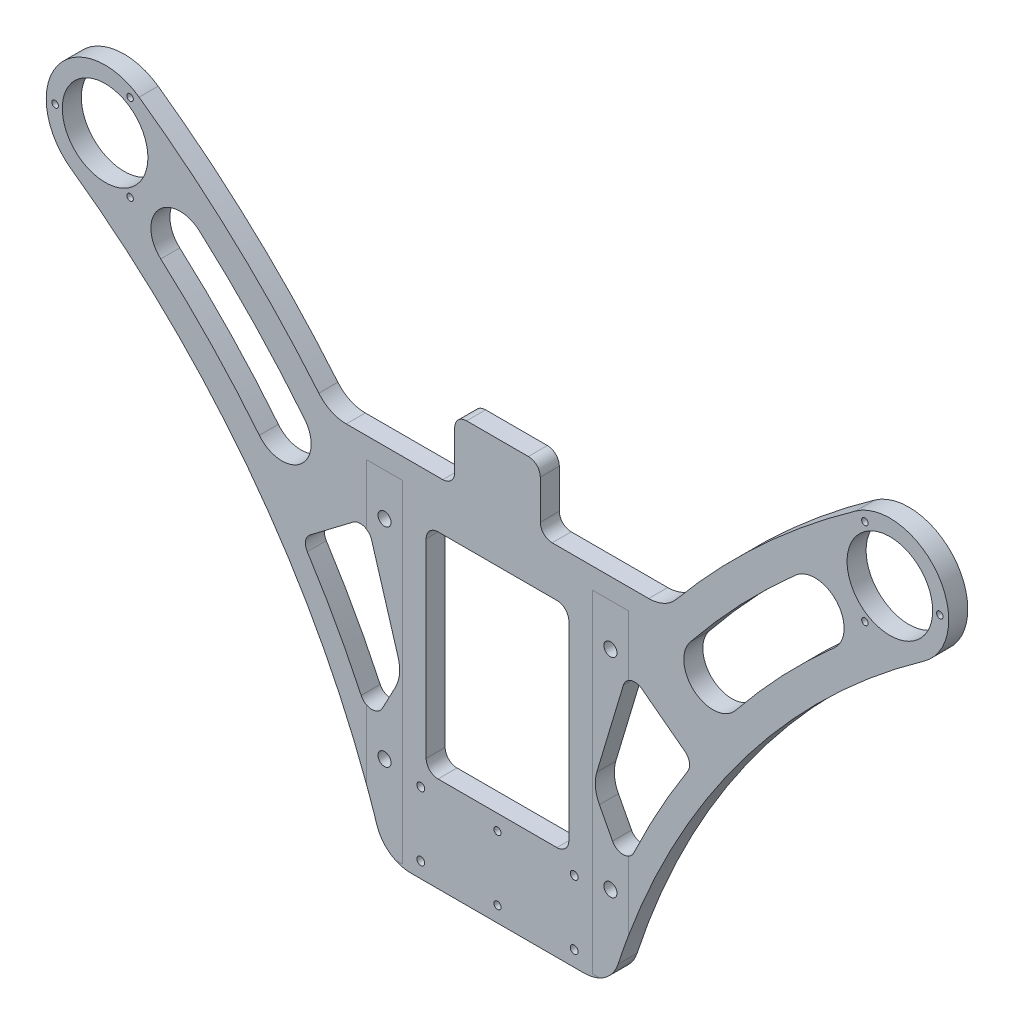
from build123d import *

# Parameters (mm, degrees)
ESTRUSIONE_ESTRUSIONE1_DEPTH  = 16
SCHIZZO3_R                    = 36
TAGLIO_ESTRUSIONE1_DEPTH      = 597.553643858
TAGLIO_ESTRUSIONE4_DEPTH      = 597.553643858
TAGLIO_ESTRUSIONE4_DEPTH_BACK = 597.553643858
RACCORDO2_R                   = 10
TAGLIO_ESTRUSIONE16_DEPTH     = 597.553643858
RACCORDO3_R                   = 30
SCHIZZO39_W                   = 120
SCHIZZO39_H                   = 180
TAGLIO_ESTRUSIONE25_DEPTH     = 597.553643858
RACCORDO5_R                   = 10
TAGLIO_ESTRUSIONE26_DEPTH     = 597.553643858
RACCORDO6_R                   = 10
RACCORDO7_R                   = 30
M6_CLEARANCE_HOLE1_D          = 6.6
RIPETIZIONE_A_L3_COUNT        = 2
RIPETIZIONE_A_L3_PITCH        = 54
RIPETIZIONE_A_L3_COUNT_DIR2   = 2
RIPETIZIONE_A_L3_PITCH_DIR2   = 129
F_6_0_6_DIAMETER_HOLE2_D      = 6
RIPETIZIONE_A_L4_COUNT        = 2
RIPETIZIONE_A_L4_PITCH        = 54
F_11_0_11_DIAMETER_HOLE1_D    = 11
RIPETIZIONE_A_L5_COUNT        = 2
RIPETIZIONE_A_L5_PITCH        = 190
RIPETIZIONE_A_L5_COUNT_DIR2   = 2
RIPETIZIONE_A_L5_PITCH_DIR2   = 175
M5_CLEARANCE_HOLE1_D          = 5.5
RIPETIZIONECIRCOLARE1_COUNT   = 3
SPECCHIA7_COPY_1_D            = 5.5
SPECCHIA7_COPY_2_D            = 5.5


# Read off the part's stored shape, not the designer's step: Specchia8
with BuildPart() as part:
    # Schizzo2 → Estrusione-Estrusione1 (new body)
    with BuildSketch(Plane.XY):
        with BuildLine():
            Line((-330, 0), (330, 0))
            ThreePointArc((330, 0), (377.167935033, -34.485476873), (358.614305107, -89.891478597))
            ThreePointArc((358.614305107, -89.891478597), (195.466897987, -252.623261021), (95, -460))
            Line((95, -460), (-95, -460))
            ThreePointArc((-95, -460), (-195.466897987, -252.623261021), (-358.614305107, -89.891478597))
            ThreePointArc((-358.614305107, -89.891478597), (-377.167935033, -34.485476873), (-330, 0))
        make_face()
    extrude(amount=-ESTRUSIONE_ESTRUSIONE1_DEPTH)

    # Schizzo3 → Taglio-Estrusione1 (cut, symmetric)
    with BuildSketch(Plane.XY):
        with Locations((-330, -49.5)):
            Circle(SCHIZZO3_R)
    taglio_estrusione1 = extrude(amount=TAGLIO_ESTRUSIONE1_DEPTH, both=True, mode=Mode.SUBTRACT)

    # Specchia1: Taglio-Estrusione1 across plane
    add(taglio_estrusione1.mirror(Plane(origin=(0, 0, 0), x_dir=(0, 0, 1), z_dir=(1, 0, 0))), mode=Mode.SUBTRACT)

    # Schizzo12 → Taglio-Estrusione4 (cut, two sides: drawn at the far end of the back side and taken through both)
    with BuildSketch(Plane(origin=(0, 0, -16), x_dir=(-1, 0, 0), z_dir=(0, 0, -1)).offset(-TAGLIO_ESTRUSIONE4_DEPTH_BACK)):
        with BuildLine():
            Line((-330, 0), (330, 0))
            ThreePointArc((330, 0), (314.985476873, -2.332064967), (301.385694893, -9.108521403))
            ThreePointArc((301.385694893, -9.108521403), (216.113325417, -78.953204124), (141.406742184, -160))
            Line((141.406742184, -160), (36, -160))
            Line((36, -160), (36, -107.15))
            Line((36, -107.15), (-36, -107.15))
            Line((-36, -107.15), (-36, -160))
            Line((-36, -160), (-141.406742184, -160))
            ThreePointArc((-141.406742184, -160), (-216.113325417, -78.953204124), (-301.385694893, -9.108521403))
            ThreePointArc((-301.385694893, -9.108521403), (-314.985476873, -2.332064967), (-330, 0))
        make_face()
    extrude(amount=TAGLIO_ESTRUSIONE4_DEPTH + TAGLIO_ESTRUSIONE4_DEPTH_BACK, mode=Mode.SUBTRACT)

    # Raccordo2
    raccordo2_edges = [part.edges().sort_by_distance(p)[0] for p in [
        (36, -160, -8),
        (36, -107.15, -8),
        (-36, -160, -8),
        (-36, -107.15, -8),
    ]]
    fillet(raccordo2_edges, radius=RACCORDO2_R)

    # Schizzo24 → Taglio-Estrusione16 (cut, through all)
    with BuildSketch(Plane(origin=(0, 0, -16), x_dir=(-1, 0, 0), z_dir=(0, 0, -1))):
        with BuildLine():
            ThreePointArc((200.293142061, -204.853472831), (239.934023772, -159.597976721), (283.239119921, -117.835217253))
            ThreePointArc((283.239119921, -117.835217253), (285.324112305, -83.249775131), (250.738670183, -81.164782747))
            ThreePointArc((250.738670183, -81.164782747), (204.4658122, -125.789605452), (162.108282651, -174.146527169))
            ThreePointArc((162.108282651, -174.146527169), (165.847239525, -208.592429705), (200.293142061, -204.853472831))
        make_face()
    taglio_estrusione16 = extrude(amount=-TAGLIO_ESTRUSIONE16_DEPTH, mode=Mode.SUBTRACT)

    # Specchia3: Taglio-Estrusione16 across plane
    add(taglio_estrusione16.mirror(Plane(origin=(0, 0, 0), x_dir=(0, 0, 1), z_dir=(1, 0, 0))), mode=Mode.SUBTRACT)

    # Raccordo3
    raccordo3_edges = [part.edges().sort_by_distance(p)[0] for p in [
        (-141.406742184, -160, -8),
        (141.406742184, -160, -8),
        (-95, -460, -8),
        (95, -460, -8),
    ]]
    fillet(raccordo3_edges, radius=RACCORDO3_R)

    # Schizzo39 → Taglio-Estrusione25 (cut, through all)
    with BuildSketch(Plane(origin=(0, 0, -16), x_dir=(-1, 0, 0), z_dir=(0, 0, -1))):
        with Locations((0, -290)):
            Rectangle(SCHIZZO39_W, SCHIZZO39_H)
    extrude(amount=-TAGLIO_ESTRUSIONE25_DEPTH, mode=Mode.SUBTRACT)

    # Raccordo5
    raccordo5_edges = [part.edges().sort_by_distance(p)[0] for p in [
        (60, -380, -8),
        (60, -200, -8),
        (-60, -200, -8),
        (-60, -380, -8),
    ]]
    fillet(raccordo5_edges, radius=RACCORDO5_R)

    # Schizzo40 → Taglio-Estrusione26 (cut, through all)
    with BuildSketch(Plane(origin=(0, 0, -16), x_dir=(-1, 0, 0), z_dir=(0, 0, -1))):
        with BuildLine():
            Line((165, -261.686426461), (110, -220))
            Line((110, -220), (80, -320))
            Line((80, -320), (106.286172484, -370))
            ThreePointArc((106.286172484, -370), (133.289241422, -314.567258295), (165, -261.686426461))
        make_face()
    taglio_estrusione26 = extrude(amount=-TAGLIO_ESTRUSIONE26_DEPTH, mode=Mode.SUBTRACT)

    # Specchia6: Taglio-Estrusione26 across plane
    add(taglio_estrusione26.mirror(Plane(origin=(0, 0, 0), x_dir=(0, 0, 1), z_dir=(1, 0, 0))), mode=Mode.SUBTRACT)

    # Raccordo6
    raccordo6_edges = [part.edges().sort_by_distance(p)[0] for p in [
        (-165, -261.686426461, -8),
        (-106.286172484, -370, -8),
        (-110, -220, -8),
        (106.286172484, -370, -8),
        (165, -261.686426461, -8),
        (110, -220, -8),
    ]]
    fillet(raccordo6_edges, radius=RACCORDO6_R)

    # Raccordo7
    raccordo7_edges = [part.edges().sort_by_distance(p)[0] for p in [
        (-80, -320, -8),
        (80, -320, -8),
    ]]
    fillet(raccordo7_edges, radius=RACCORDO7_R)

    # M6 Clearance Hole1 (through all)
    with Locations(Plane(origin=(0, 0, -16), x_dir=(-1, 0, 0), z_dir=(0, 0, -1))):
        with Locations((64.5, -393)):
            m6_clearance_hole1 = Hole(M6_CLEARANCE_HOLE1_D / 2)

    # Ripetizione a L3: M6 Clearance Hole1 2 × 2
    with Locations(*[(j * RIPETIZIONE_A_L3_PITCH_DIR2, -i * RIPETIZIONE_A_L3_PITCH, 0) for i in range(RIPETIZIONE_A_L3_COUNT) for j in range(RIPETIZIONE_A_L3_COUNT_DIR2) if (i, j) != (0, 0)]):
        add(m6_clearance_hole1, mode=Mode.SUBTRACT)

    # Ø6.0 (6) Diameter Hole2 (through all)
    with Locations(Plane(origin=(0, 0, -16), x_dir=(-1, 0, 0), z_dir=(0, 0, -1))):
        with Locations((0, -393)):
            f_6_0_6_diameter_hole2 = Hole(F_6_0_6_DIAMETER_HOLE2_D / 2)

    # Ripetizione a L4: Ø6.0 (6) Diameter Hole2 ×2
    with Locations(*[(0, -i * RIPETIZIONE_A_L4_PITCH, 0) for i in range(1, RIPETIZIONE_A_L4_COUNT)]):
        add(f_6_0_6_diameter_hole2, mode=Mode.SUBTRACT)

    # Ø11.0 (11) Diameter Hole1 (through all)
    with Locations(Plane.XY):
        with Locations((-95, -213)):
            f_11_0_11_diameter_hole1 = Hole(F_11_0_11_DIAMETER_HOLE1_D / 2)

    # Ripetizione a L5: 11.0 _11_ Diameter Hole1 2 × 2
    with Locations(*[(i * RIPETIZIONE_A_L5_PITCH, -j * RIPETIZIONE_A_L5_PITCH_DIR2, 0) for i in range(RIPETIZIONE_A_L5_COUNT) for j in range(RIPETIZIONE_A_L5_COUNT_DIR2) if (i, j) != (0, 0)]):
        add(f_11_0_11_diameter_hole1, mode=Mode.SUBTRACT)

    # M5 Clearance Hole1 (through all)
    with Locations(Plane.XY):
        with Locations((-372, -49.5)):
            m5_clearance_hole1 = Hole(M5_CLEARANCE_HOLE1_D / 2)

    # RipetizioneCircolare1: M5 Clearance Hole1 ×3 about axis
    ripetizionecircolare1_axis = Axis((-330, -49.5, 0), (0, 0, 1))
    for i in range(1, RIPETIZIONECIRCOLARE1_COUNT):
        add(m5_clearance_hole1.rotate(ripetizionecircolare1_axis, i * 360 / RIPETIZIONECIRCOLARE1_COUNT), mode=Mode.SUBTRACT)

    # Specchia7: M5 Clearance Hole1 across plane
    add(m5_clearance_hole1.mirror(Plane(origin=(0, 0, 0), x_dir=(0, 0, 1), z_dir=(1, 0, 0))), mode=Mode.SUBTRACT)

    # Specchia7 copy 1 (through all)
    with Locations(Plane(origin=(537.868257487, 211.538383249, 0), x_dir=(0.4999999999999998, 0.8660254037844387, 0), z_dir=(0, 0, 1))):
        with Locations((-372, 49.5)):
            Hole(SPECCHIA7_COPY_1_D / 2)

    # Specchia7 copy 2 (through all)
    with Locations(Plane(origin=(452.131742513, -360.038383249, 0), x_dir=(0.5000000000000004, -0.8660254037844384, 0), z_dir=(0, 0, 1))):
        with Locations((-372, 49.5)):
            Hole(SPECCHIA7_COPY_2_D / 2)

    # Specchia8: part across plane


with BuildPart() as part_1:
    add(part.part)
    add(part.part.mirror(Plane(origin=(0, 0, 0), x_dir=(0, 0, 1), z_dir=(1, 0, 0))))


solid = part_1.part
